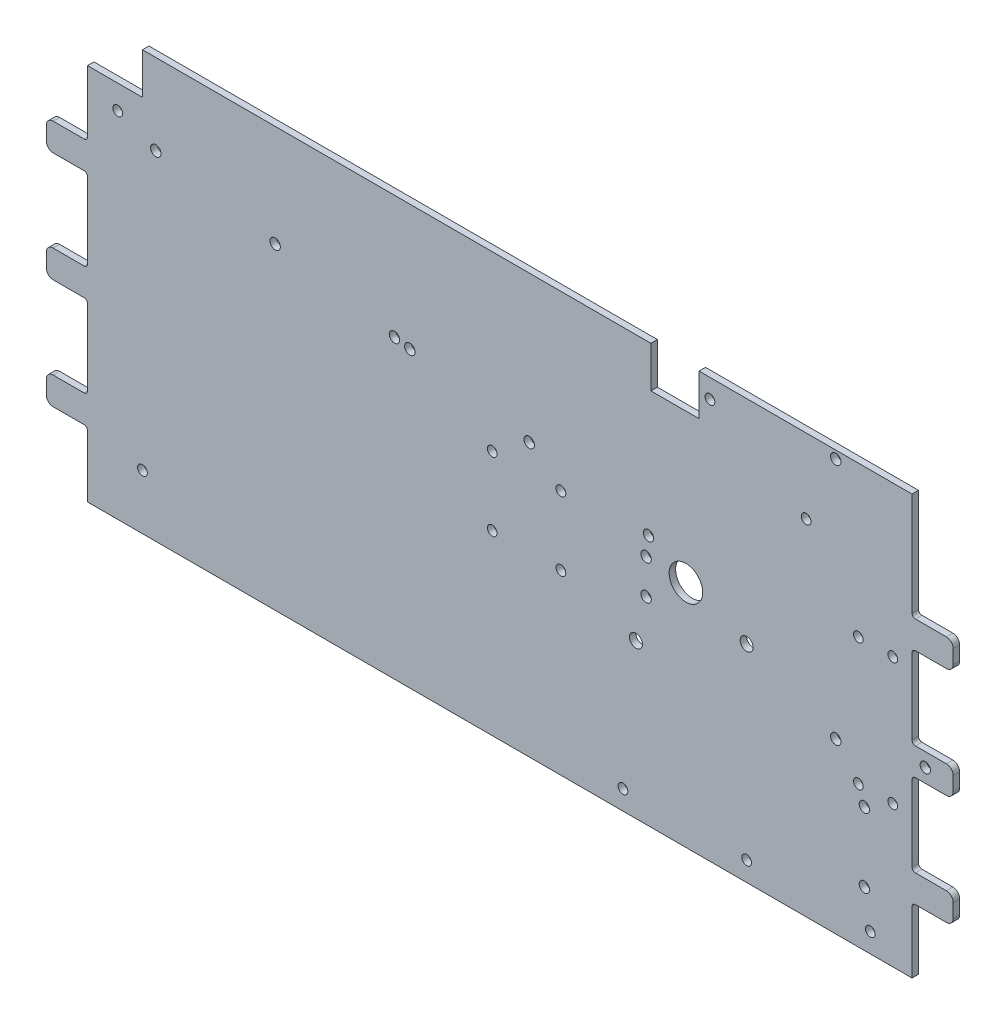
from build123d import *

# Parameters (mm, degrees)
SKETCH1_W                  = 381
SKETCH1_H                  = 193.675
BOSS_EXTRUDE1_DEPTH        = 1.5
CUT_EXTRUDE1_DEPTH         = 214.72120018
CUT_EXTRUDE1_DEPTH_BACK    = 214.72120018
SKETCH2_W                  = 25.4
SKETCH2_H                  = 19.05
SKETCH2_W_2                = 22.225
SKETCH3_W                  = 19.05
SKETCH3_H                  = 12.7
BOSS_EXTRUDE2_DEPTH        = 3
FILLET1_R                  = 3.175
FILLET1_OF_MIRROR1_R       = 3.175
FILLET2_R                  = 1.5875
LPATTERN1_START            = -1.5
LPATTERN1_DEPTH            = 3
F_1_0MM_DOWEL_HOLE6_D      = 6
F_1_0MM_DOWEL_HOLE5_D      = 6
SKETCH10_R                 = 7.75
CUT_EXTRUDE2_DEPTH         = 231.862954816
F_8_CLEARANCE_HOLE1_D      = 4.4958
F_1_0MM_DOWEL_HOLE1_D      = 4.8
F_1_0_4_8_DIAMETER_HOLE1_D = 4.8


# Read off the part's stored shape, not the designer's step: LPattern1
with BuildPart() as part:
    # Sketch1 → Boss-Extrude1 (new, symmetric)
    with BuildSketch(Plane.XY):
        Rectangle(SKETCH1_W, SKETCH1_H)
    extrude(amount=BOSS_EXTRUDE1_DEPTH, both=True)

    # Sketch2 → Cut-Extrude1 (cut, two sides: drawn at the far end of the back side and taken through both)
    with BuildSketch(Plane.XY.offset(1.5).offset(-CUT_EXTRUDE1_DEPTH_BACK)):
        with Locations((-177.8, 87.3125)):
            Rectangle(SKETCH2_W, SKETCH2_H)
        with Locations((80.9625, 87.3125)):
            Rectangle(SKETCH2_W_2, SKETCH2_H)
    extrude(amount=CUT_EXTRUDE1_DEPTH + CUT_EXTRUDE1_DEPTH_BACK, mode=Mode.SUBTRACT)

    # Sketch3 → Boss-Extrude2 (add)
    with BuildSketch(Plane.XY.offset(1.5)):
        with Locations((-200.025, -9.525)):
            Rectangle(SKETCH3_W, SKETCH3_H)
    boss_extrude2 = extrude(amount=-BOSS_EXTRUDE2_DEPTH)

    # Fillet1
    fillet1_edges = [part.edges().sort_by_distance(p)[0] for p in [
        (-209.55, -3.175, 0),
        (-209.55, -15.875, 0),
    ]]
    fillet(fillet1_edges, radius=FILLET1_R)

    # Mirror1: Boss-Extrude2 across plane
    add(boss_extrude2.mirror(Plane(origin=(0, 0, 0), x_dir=(0, 0, 1), z_dir=(1, 0, 0))))

    # Fillet1 of Mirror1
    fillet1_of_mirror1_edges = [part.edges().sort_by_distance(p)[0] for p in [
        (209.55, -3.175, 0),
        (209.55, -15.875, 0),
    ]]
    fillet(fillet1_of_mirror1_edges, radius=FILLET1_OF_MIRROR1_R)

    # Fillet2
    fillet2_edges = [part.edges().sort_by_distance(p)[0] for p in [
        (-190.5, -15.875, 0),
        (-190.5, -3.175, 0),
        (190.5, -15.875, 0),
        (190.5, -3.175, 0),
    ]]
    fillet(fillet2_edges, radius=FILLET2_R)

    # LPattern1 outline → LPattern1 (add)
    with BuildSketch(Plane.XY.offset(LPATTERN1_START)):
        with BuildLine():
            ThreePointArc((-206.375, 47.625), (-208.62006403, 46.69506403), (-209.55, 44.45))
            Line((-209.55, 44.45), (-209.55, 38.1))
            ThreePointArc((-209.55, 38.1), (-208.62006403, 35.85493597), (-206.375, 34.925))
            Line((-206.375, 34.925), (-192.0875, 34.925))
            ThreePointArc((-192.0875, 34.925), (-190.964967985, 34.460032015), (-190.5, 33.3375))
            Line((-190.5, 33.3375), (-190.5, 49.2125))
            ThreePointArc((-190.5, 49.2125), (-190.964967985, 48.089967985), (-192.0875, 47.625))
            Line((-192.0875, 47.625), (-206.375, 47.625))
        make_face()
        with BuildLine():
            ThreePointArc((-206.375, -53.975), (-208.62006403, -54.90493597), (-209.55, -57.15))
            Line((-209.55, -57.15), (-209.55, -63.5))
            ThreePointArc((-209.55, -63.5), (-208.62006403, -65.74506403), (-206.375, -66.675))
            Line((-206.375, -66.675), (-192.0875, -66.675))
            ThreePointArc((-192.0875, -66.675), (-190.964967985, -67.139967985), (-190.5, -68.2625))
            Line((-190.5, -68.2625), (-190.5, -52.3875))
            ThreePointArc((-190.5, -52.3875), (-190.964967985, -53.510032015), (-192.0875, -53.975))
            Line((-192.0875, -53.975), (-206.375, -53.975))
        make_face()
        with BuildLine():
            Line((209.55, 38.1), (209.55, 44.45))
            ThreePointArc((209.55, 44.45), (208.62006403, 46.69506403), (206.375, 47.625))
            Line((206.375, 47.625), (192.0875, 47.625))
            ThreePointArc((192.0875, 47.625), (190.964967985, 48.089967985), (190.5, 49.2125))
            Line((190.5, 49.2125), (190.5, 33.3375))
            ThreePointArc((190.5, 33.3375), (190.964967985, 34.460032015), (192.0875, 34.925))
            Line((192.0875, 34.925), (206.375, 34.925))
            ThreePointArc((206.375, 34.925), (208.62006403, 35.85493597), (209.55, 38.1))
        make_face()
        with BuildLine():
            Line((209.55, -63.5), (209.55, -57.15))
            ThreePointArc((209.55, -57.15), (208.62006403, -54.90493597), (206.375, -53.975))
            Line((206.375, -53.975), (192.0875, -53.975))
            ThreePointArc((192.0875, -53.975), (190.964967985, -53.510032015), (190.5, -52.3875))
            Line((190.5, -52.3875), (190.5, -68.2625))
            ThreePointArc((190.5, -68.2625), (190.964967985, -67.139967985), (192.0875, -66.675))
            Line((192.0875, -66.675), (206.375, -66.675))
            ThreePointArc((206.375, -66.675), (208.62006403, -65.74506403), (209.55, -63.5))
        make_face()
    extrude(amount=LPATTERN1_DEPTH)

    # Ø1.0mm Dowel Hole6 (through all)
    with Locations(Plane.XY.offset(1.5)):
        with Locations((114.080868605, -1.328387664)):
            Hole(F_1_0MM_DOWEL_HOLE6_D / 2)

    # Ø1.0mm Dowel Hole5 (through all)
    with Locations(Plane.XY.offset(1.5)):
        with Locations((62.931618599, -25.649221104)):
            Hole(F_1_0MM_DOWEL_HOLE5_D / 2)

    # Sketch10 → Cut-Extrude2 (cut, through all)
    with BuildSketch(Plane.XY.offset(1.5)):
        with Locations((86.013868605, 9.09694676)):
            Circle(SKETCH10_R)
    extrude(amount=-CUT_EXTRUDE2_DEPTH, mode=Mode.SUBTRACT)

    # #8 Clearance Hole1 (through all)
    with Locations(Plane(origin=(0, 0, -1.5), x_dir=(-1, 0, 0), z_dir=(0, 0, -1))):
        with Locations((3.488631395, 16.97194676), (-28.261368605, 16.97194676), (-28.261368605, -14.77805324), (3.488631395, -14.77805324), (-56.930868605, -87.847137664), (-114.080868605, -87.847137664), (-171.230868605, -87.847137664), (-165.723368605, 27.246612336), (-181.598368605, 27.246612336), (-181.598368605, -31.490887664), (-165.723368605, -31.490887664), (176.53, 66.736172691), (-97.1296, 88.08565122), (-141.5796, 62.4224304), (165.1, -71.4375)):
            Hole(F_8_CLEARANCE_HOLE1_D / 2)

    # Ø1.0mm Dowel Hole1 (through all)
    with Locations(Plane.XY.offset(1.5)):
        with Locations((-158.944770876, 59.513399002), (-48.646302539, 40.064803103), (-103.795536708, 49.789101052), (-41.555686717, 38.814536224), (13.593547451, 29.090238275), (68.74278162, 19.365940325), (67.618368605, 10.356435791), (67.618368605, -5.643564209), (155.263089531, -18.7625), (155.263089531, 93.2375), (168.480868605, -71.388387664), (168.480868605, -39.388387664)):
            Hole(F_1_0MM_DOWEL_HOLE1_D / 2)

    # Ø1.0 (4.8) Diameter Hole1 (through all)
    with Locations(Plane.XY.offset(1.5)):
        with Locations((196.65, -9.525)):
            Hole(F_1_0_4_8_DIAMETER_HOLE1_D / 2)


solid = part.part
